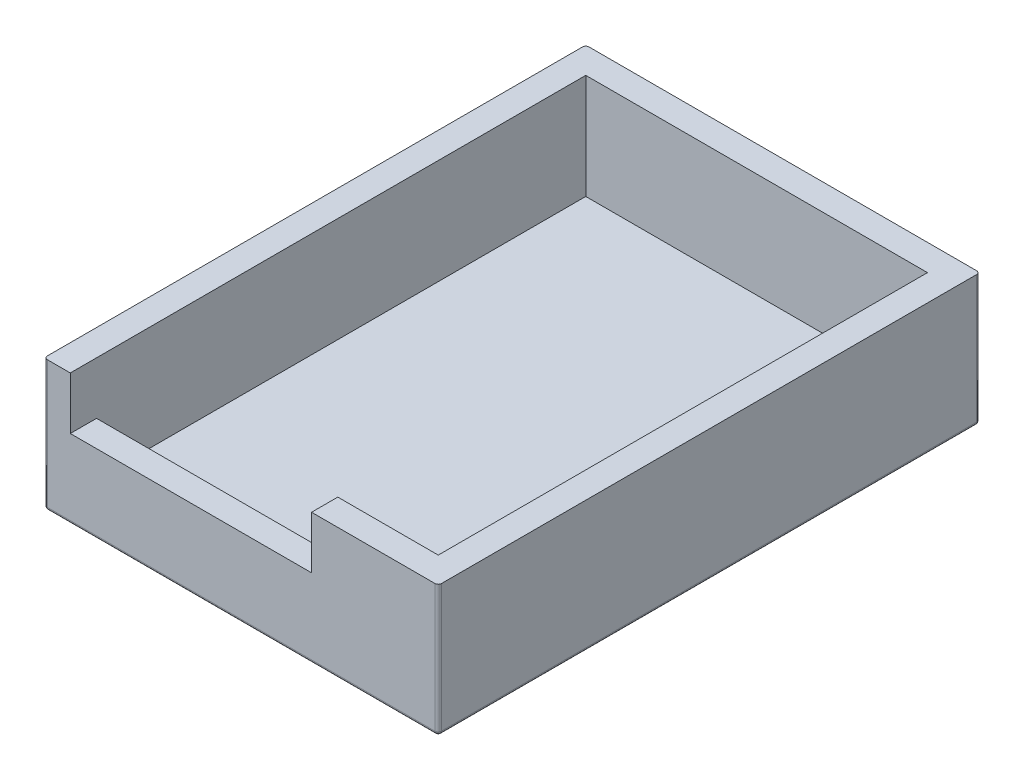
from build123d import *

# Parameters (mm, degrees)
SKETCH1_W           = 30.06
SKETCH1_H           = 41.31
BOSS_EXTRUDE1_DEPTH = 10
SHELL2_T            = -2
SKETCH4_W           = 18.4
SKETCH4_H           = 2
CUT_EXTRUDE1_DEPTH  = 4
FILLET1_R           = 0.25
SKETCH5_R           = 1.5
CUT_EXTRUDE2_DEPTH  = 28.432278888
SKETCH6_R           = 1.5
CUT_EXTRUDE3_DEPTH  = 28.432278888


with BuildPart() as part:
    # Sketch1 → Boss-Extrude1 (new body)
    with BuildSketch(Plane(origin=(0, 0, 0), x_dir=(1, 0, 0), z_dir=(0, 1, 0))):
        Rectangle(SKETCH1_W, SKETCH1_H)
    extrude(amount=BOSS_EXTRUDE1_DEPTH)

    # Shell2
    shell2_openings = [part.faces().sort_by_distance(p)[0] for p in [
        (0, 10, 0),
    ]]
    offset(amount=SHELL2_T, openings=shell2_openings, kind=Kind.INTERSECTION)

    # Sketch4 → Cut-Extrude1 (cut)
    with BuildSketch(Plane(origin=(0, 10, 0), x_dir=(1, 0, 0), z_dir=(0, 1, 0))):
        with Locations((-3.83, -19.655)):
            Rectangle(SKETCH4_W, SKETCH4_H)
    extrude(amount=-CUT_EXTRUDE1_DEPTH, mode=Mode.SUBTRACT)

    # Fillet1
    fillet1_edges = [part.edges().sort_by_distance(p)[0] for p in [
        (0, 0, -20.655),
        (-15.03, 0, 0),
        (-15.03, 5, -20.655),
        (15.03, 5, -20.655),
        (-15.03, 5, 20.655),
        (15.03, 0, 0),
        (15.03, 5, 20.655),
        (0, 0, 20.655),
    ]]
    fillet(fillet1_edges, radius=FILLET1_R)

    # Sketch5 → Cut-Extrude2 (cut, through all)
    with BuildSketch(Plane.XZ):
        with Locations((3.955545026, 14.646376422)):
            Circle(SKETCH5_R)
    extrude(amount=-CUT_EXTRUDE2_DEPTH, mode=Mode.SUBTRACT)

    # Sketch6 → Cut-Extrude3 (cut, through all)
    with BuildSketch(Plane.XZ):
        with Locations((8.578599531, 11.725378803)):
            Circle(SKETCH6_R)
    extrude(amount=-CUT_EXTRUDE3_DEPTH, mode=Mode.SUBTRACT)


solid = part.part
